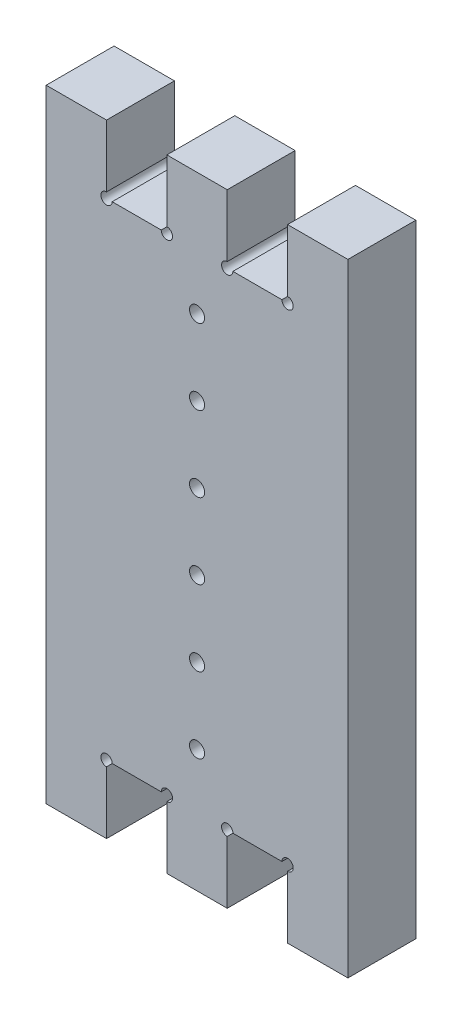
from build123d import *

# Parameters (mm, degrees)
SKETCH1_R           = 2
BOSS_EXTRUDE1_DEPTH = 18
SKETCH2_R           = 1.5
CUT_EXTRUDE1_DEPTH  = 94.435806841


with BuildPart() as part:
    # Sketch1 → Boss-Extrude1 (new body)
    with BuildSketch(Plane.XY):
        Polygon((-24, 64.5), (-8, 64.5), (-8, 82.5), (8, 82.5), (8, 64.5), (24, 64.5), (24, 82.5), (40, 82.5), (40, -82.5), (24, -82.5), (24, -64.5), (8, -64.5), (8, -82.5), (-8, -82.5), (-8, -64.5), (-24, -64.5), (-24, -82.5), (-40, -82.5), (-40, 82.5), (-24, 82.5), align=None)
        with Locations((0, 50)):
            Circle(SKETCH1_R, mode=Mode.SUBTRACT)
        with Locations((0, 30)):
            Circle(SKETCH1_R, mode=Mode.SUBTRACT)
        with Locations((0, -30)):
            Circle(SKETCH1_R, mode=Mode.SUBTRACT)
        with Locations((0, -50)):
            Circle(SKETCH1_R, mode=Mode.SUBTRACT)
        with Locations((0, 10)):
            Circle(SKETCH1_R, mode=Mode.SUBTRACT)
        with Locations((0, -10)):
            Circle(SKETCH1_R, mode=Mode.SUBTRACT)
    extrude(amount=BOSS_EXTRUDE1_DEPTH)

    # Sketch2 → Cut-Extrude1 (cut, through all)
    with BuildSketch(Plane.XY.offset(18)):
        with Locations((-24, 64.5)):
            Circle(SKETCH2_R)
        with Locations((-8, 64.5)):
            Circle(SKETCH2_R)
        with Locations((8, 64.5)):
            Circle(SKETCH2_R)
        with Locations((24, 64.5)):
            Circle(SKETCH2_R)
        with Locations((24, -64.5)):
            Circle(SKETCH2_R)
        with Locations((8, -64.5)):
            Circle(SKETCH2_R)
        with Locations((-8, -64.5)):
            Circle(SKETCH2_R)
        with Locations((-24, -64.5)):
            Circle(SKETCH2_R)
    extrude(amount=-CUT_EXTRUDE1_DEPTH, mode=Mode.SUBTRACT)


solid = part.part
